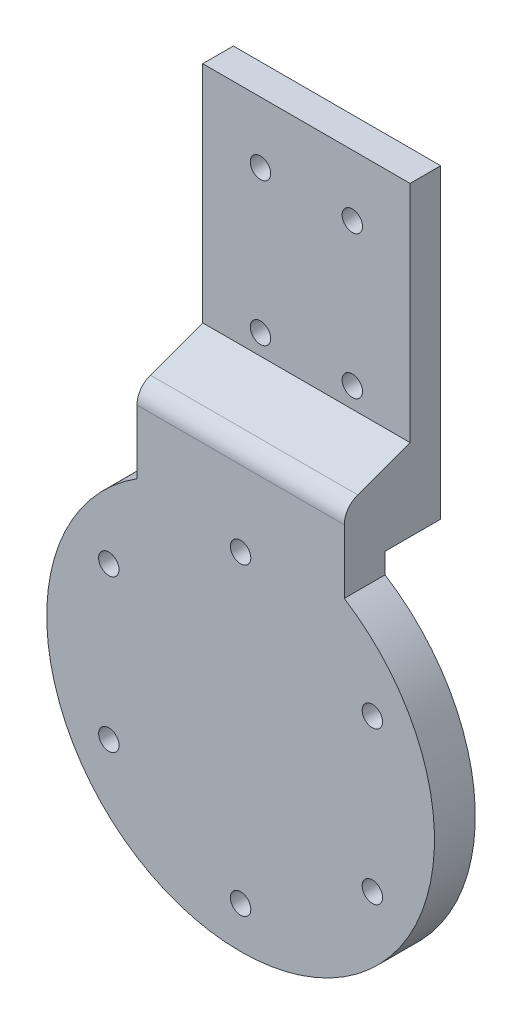
from build123d import *

# Parameters (mm, degrees)
SKETCH1_W           = 50.8
SKETCH1_H           = 65.000000038
SKETCH1_R           = 2.5
EXTRUDE_5_DEPTH     = 7.5
SKETCH1_3_W         = 50.8
SKETCH1_3_H         = 10
BOSS_EXTRUDE1_DEPTH = 13.625
BOSS_EXTRUDE2_START = 13.625
SKETCH1_4_R         = 2.5
SKETCH1_4_W         = 50.8
SKETCH1_4_H         = 10
BOSS_EXTRUDE2_DEPTH = 10
CHAMFER1_SIZE       = 10
CHAMFER1_SIZE_2     = 27.474774195
FILLET1_R           = 5


with BuildPart() as part:
    # Sketch1 → 5 (new body)
    with BuildSketch(Plane.XY):
        with Locations((0, 87.638385637)):
            Rectangle(SKETCH1_W, SKETCH1_H)
        with Locations((-11.25, 70.138385656)):
            Circle(SKETCH1_R, mode=Mode.SUBTRACT)
        with Locations((-11.25, 105.138385656)):
            Circle(SKETCH1_R, mode=Mode.SUBTRACT)
        with Locations((11.25, 70.138385656)):
            Circle(SKETCH1_R, mode=Mode.SUBTRACT)
        with Locations((11.25, 105.138385656)):
            Circle(SKETCH1_R, mode=Mode.SUBTRACT)
    extrude(amount=EXTRUDE_5_DEPTH)

    # Sketch1<3> → Boss-Extrude1 (add)
    with BuildSketch(Plane.XY):
        with Locations((0, 50.138385618)):
            Rectangle(SKETCH1_3_W, SKETCH1_3_H)
    extrude(amount=BOSS_EXTRUDE1_DEPTH)

    # Sketch1<4> → Boss-Extrude2 (add)
    # profile 1 of 2: a face of its own
    with BuildSketch(Plane.XY.offset(BOSS_EXTRUDE2_START)):
        with BuildLine():
            Line((-25.4, 45.138385618), (-25.4, 40.138385618))
            ThreePointArc((-25.4, 40.138385618), (0, -47.5), (25.4, 40.138385618))
            Line((25.4, 40.138385618), (25.4, 45.138385618))
            Line((25.4, 45.138385618), (-25.4, 45.138385618))
        make_face()
        with Locations((-32.285427053, -18.64)):
            Circle(SKETCH1_4_R, mode=Mode.SUBTRACT)
        with Locations((-32.285427053, 18.64)):
            Circle(SKETCH1_4_R, mode=Mode.SUBTRACT)
        with Locations((0, -37.28)):
            Circle(SKETCH1_4_R, mode=Mode.SUBTRACT)
        with Locations((32.285427053, -18.64)):
            Circle(SKETCH1_4_R, mode=Mode.SUBTRACT)
        with Locations((32.285427053, 18.64)):
            Circle(SKETCH1_4_R, mode=Mode.SUBTRACT)
        with Locations((0, 37.28)):
            Circle(SKETCH1_4_R, mode=Mode.SUBTRACT)
    # profile 2 of 2: a face of its own
    with BuildSketch(Plane.XY.offset(BOSS_EXTRUDE2_START)):
        with Locations((0, 50.138385618)):
            Rectangle(SKETCH1_4_W, SKETCH1_4_H)
    extrude(amount=BOSS_EXTRUDE2_DEPTH)

    # Chamfer1
    # the kernel refuses this chamfer: 27.474774195, 10 mm, written as the material it adds along each edge
    with BuildSketch(Plane(origin=(-25.4, 55.138385618, 7.5), x_dir=(0, 0.9950833631817486, -0.0990409022520505), z_dir=(1, 0, 0))) as chamfer1_piece_1_section:
        Polygon((CHAMFER1_SIZE * 0.995083363182, CHAMFER1_SIZE * 0.0990409022521), (-CHAMFER1_SIZE_2 * 0.0990409022504, CHAMFER1_SIZE_2 * 0.995083363165), (0, 0), align=None)
    chamfer1_piece_1 = extrude(amount=50.8, mode=Mode.PRIVATE)
    chamfer1_piece_1 = split(chamfer1_piece_1, bisect_by=Plane(origin=(0, 58.7545268, 23.625), z_dir=(0, 0, -1)), keep=Keep.TOP, mode=Mode.PRIVATE)
    add(chamfer1_piece_1)

    # Fillet1
    fillet1_edges = [part.edges().sort_by_distance(p)[0] for p in [
        (0, 59.26936559, 23.625),
    ]]
    fillet(fillet1_edges, radius=FILLET1_R)


solid = part.part
